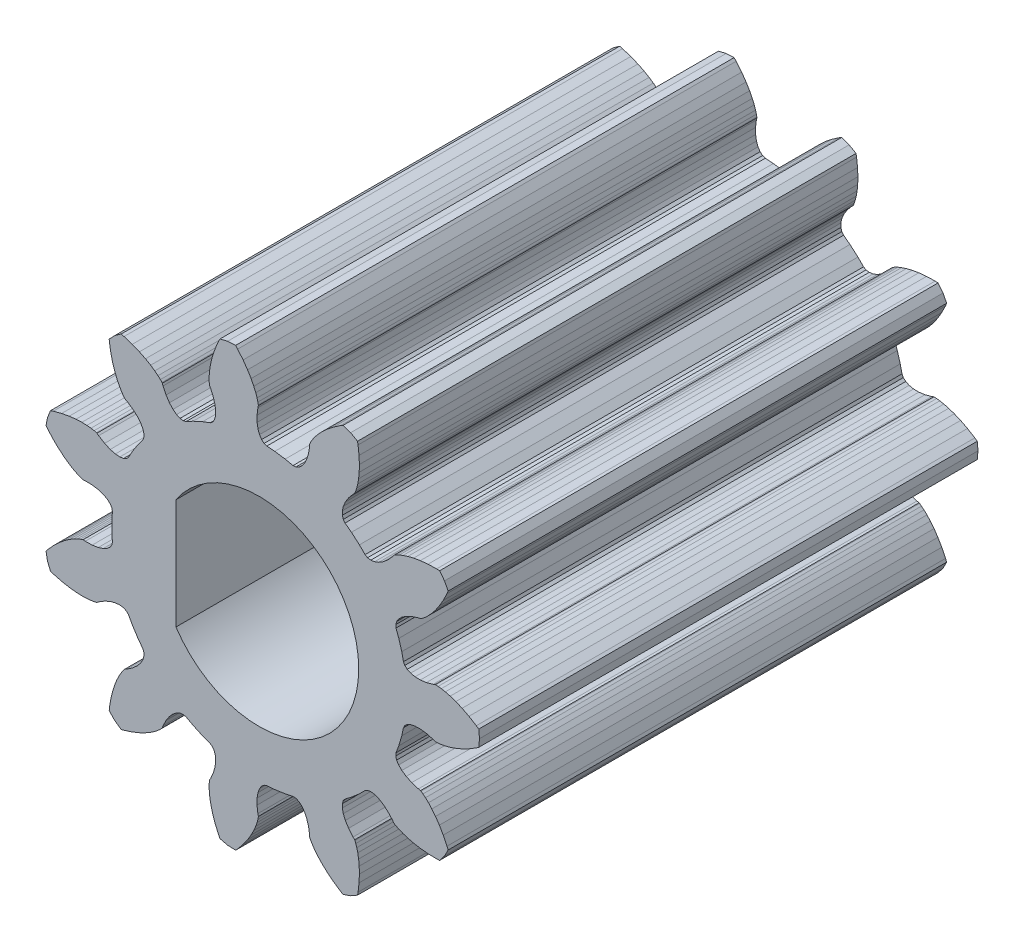
from build123d import *

# Parameters (mm, degrees)
BOSS_EXTRUDE1_DEPTH = 15


with BuildPart() as part:
    # Model → Boss-Extrude1 (new body)
    with BuildSketch(Plane.XY):
        Polygon((5.34350911, -3.778393981), (5.432682734, -3.774472376), (5.580572011, -3.586415862), (5.690198807, -3.373769544), (5.656721963, -3.291025269), (5.542565598, -3.05819118), (5.425718856, -2.857502407), (5.310117013, -2.688037058), (5.199541768, -2.548480823), (5.097585706, -2.437144774), (5.007618553, -2.351986199), (4.932755481, -2.290632311), (4.875827694, -2.250406645), (4.859603729, -2.240598683), (4.795175455, -2.228424948), (4.595393071, -2.165079302), (4.429229547, -2.086621619), (4.297677307, -1.99753099), (4.201261019, -1.902340691), (4.140035663, -1.805594294), (4.113588478, -1.71180183), (4.121044753, -1.625396341), (4.205247262, -1.39964068), (4.294381996, -1.096075651), (4.345599064, -0.860634591), (4.38604078, -0.783914501), (4.458997603, -0.719309687), (4.562808701, -0.671022364), (4.695383005, -0.64306977), (4.854217822, -0.639244475), (5.0364209, -0.663076455), (5.238735778, -0.717797218), (5.299517909, -0.742388575), (5.318468961, -0.74290893), (5.3881073, -0.739846431), (5.48425654, -0.728706289), (5.605981927, -0.705706252), (5.751945637, -0.667166016), (5.920417249, -0.609545331), (6.109287593, -0.529481083), (6.31608587, -0.423823062), (6.537999927, -0.289668152), (6.610897374, -0.238158187), (6.633638723, 0), (6.610897374, 0.238158187), (6.537999927, 0.289668152), (6.31608587, 0.423823062), (6.109287593, 0.529481083), (5.920417249, 0.609545331), (5.751945637, 0.667166016), (5.605981927, 0.705706252), (5.48425654, 0.728706289), (5.3881073, 0.739846431), (5.318468961, 0.74290893), (5.299517909, 0.742388575), (5.238735778, 0.717797218), (5.0364209, 0.663076455), (4.854217822, 0.639244475), (4.695383005, 0.64306977), (4.562808701, 0.671022364), (4.458997603, 0.719309687), (4.38604078, 0.783914501), (4.345599064, 0.860634591), (4.294381996, 1.096075651), (4.205247262, 1.39964068), (4.121044753, 1.625396341), (4.113588478, 1.71180183), (4.140035663, 1.805594294), (4.201261019, 1.902340691), (4.297677307, 1.99753099), (4.429229547, 2.086621619), (4.595393071, 2.165079302), (4.795175455, 2.228424948), (4.859603729, 2.240598683), (4.875827694, 2.250406645), (4.932755481, 2.290632311), (5.007618553, 2.351986199), (5.097585706, 2.437144774), (5.199541768, 2.548480823), (5.310117013, 2.688037058), (5.425718856, 2.857502407), (5.542565598, 3.05819118), (5.656721963, 3.291025269), (5.690198807, 3.373769544), (5.580572011, 3.586415862), (5.432682734, 3.774472376), (5.34350911, 3.778393981), (5.084293505, 3.771276476), (4.853200685, 3.74835807), (4.65102684, 3.713601384), (4.478147407, 3.670992359), (4.334518496, 3.62450053), (4.219681825, 3.578039679), (4.132773122, 3.535429159), (4.072533912, 3.500356169), (4.056872598, 3.489672706), (4.019034506, 3.436123839), (3.878420678, 3.280710122), (3.738026237, 3.162154964), (3.602337774, 3.079500422), (3.47569686, 3.031340561), (3.362259309, 3.015837924), (3.265956125, 3.030743516), (3.190456376, 3.07342012), (3.02008079, 3.243795706), (2.780976234, 3.450980983), (2.588087852, 3.595375418), (2.535100899, 3.664033174), (2.506641653, 3.757234844), (2.505842648, 3.871724019), (2.53548943, 4.003929775), (2.597992187, 4.150000092), (2.695360412, 4.305837678), (2.829180807, 4.467137938), (2.876799701, 4.512211691), (2.885145585, 4.529234011), (2.91128865, 4.59385148), (2.941097058, 4.685939687), (2.970742041, 4.806219554), (2.996320126, 4.955003008), (3.013892144, 5.132186674), (3.019522719, 5.337249073), (3.009319911, 5.56925133), (2.979474744, 5.82684142), (2.962902325, 5.914549283), (2.755713116, 6.034170028), (2.529629712, 6.112418255), (2.452491906, 6.067506419), (2.238273876, 5.921376255), (2.056256851, 5.777157854), (1.904968273, 5.638615237), (1.782569017, 5.509304566), (1.686876069, 5.392541498), (1.615387946, 5.291370752), (1.565312678, 5.208538109), (1.533598121, 5.146465056), (1.526198901, 5.129010409), (1.523318175, 5.063505419), (1.489049295, 4.856741506), (1.435037733, 4.681103595), (1.365575754, 4.538211449), (1.285075823, 4.429229547), (1.198027441, 4.354858929), (1.108953476, 4.315332879), (1.022366332, 4.310416477), (0.786925272, 4.361633545), (0.473764902, 4.406659209), (0.233431343, 4.423848204), (0.151736697, 4.452959875), (0.077406629, 4.515979878), (0.014836942, 4.611862326), (-0.031698426, 4.739109146), (-0.058089337, 4.895782858), (-0.060430133, 5.079523015), (-0.035058758, 5.287566196), (-0.019367905, 5.351229368), (-0.021549862, 5.37006158), (-0.034491757, 5.438555262), (-0.059201972, 5.532140434), (-0.099291231, 5.649353586), (-0.158211985, 5.788346748), (-0.239222185, 5.946903283), (-0.345350547, 6.122456869), (-0.479363585, 6.312113533), (-0.643734654, 6.512676591), (-0.705094711, 6.577501414), (-0.944065222, 6.566117846), (-1.17656287, 6.509714527), (-1.21717415, 6.430228439), (-1.318381893, 6.191480912), (-1.393534004, 5.97175084), (-1.445904262, 5.773408593), (-1.478962441, 5.5984515), (-1.496337591, 5.448488643), (-1.501780193, 5.324728999), (-1.499123481, 5.227973011), (-1.492244238, 5.158607652), (-1.489032163, 5.139923548), (-1.456040912, 5.083259806), (-1.373084718, 4.890791778), (-1.323565112, 4.71383491), (-1.30474692, 4.556072406), (-1.313547707, 4.420869448), (-1.346569674, 4.311242995), (-1.400134066, 4.229834544), (-1.470317799, 4.178886059), (-1.69607346, 4.094683551), (-1.983863439, 3.963254271), (-2.195337967, 3.847780443), (-2.279802834, 3.828103278), (-2.376404453, 3.84093321), (-2.480879388, 3.887766932), (-2.588822256, 3.969654849), (-2.695727906, 4.087189159), (-2.797034538, 4.240495685), (-2.888167414, 4.429229547), (-2.909386338, 4.491269531), (-2.92140338, 4.505932541), (-2.969321275, 4.556556176), (-3.040704795, 4.621925681), (-3.13780024, 4.69885777), (-3.262512909, 4.783931294), (-3.41638516, 4.873520119), (-3.600577454, 4.963827868), (-3.81585253, 5.050924289), (-4.062562848, 5.130782961), (-4.149229158, 5.152143321), (-4.344109523, 5.013369641), (-4.509205054, 4.840222431), (-4.500396013, 4.751398363), (-4.456460727, 4.495834126), (-4.40088766, 4.270355128), (-4.337712409, 4.075185513), (-4.270933774, 3.91012964), (-4.204474639, 3.774579141), (-4.142143731, 3.66752341), (-4.087598527, 3.587563421), (-4.044309595, 3.532928767), (-4.031506037, 3.518947277), (-3.973117298, 3.489115121), (-3.799274035, 3.372050217), (-3.661945385, 3.249956947), (-3.560821666, 3.127412566), (-3.495129121, 3.008914535), (-3.463640432, 2.898837871), (-3.464688935, 2.801393627), (-3.496186418, 2.720588843), (-3.640580853, 2.527700461), (-3.811629156, 2.261544105), (-3.927102984, 2.050069578), (-3.987521074, 1.987850939), (-4.075723912, 1.946417386), (-4.188934042, 1.929333005), (-4.324013311, 1.939863185), (-4.477491912, 1.98094178), (-4.64560024, 2.055140936), (-4.824303324, 2.164643812), (-4.875695166, 2.205363351), (-4.893731967, 2.211201757), (-4.961412269, 2.227882699), (-5.05680533, 2.244282182), (-5.180079843, 2.256507812), (-5.330989036, 2.260651456), (-5.508869987, 2.252828751), (-5.71264646, 2.229218592), (-5.940835258, 2.186102271), (-6.191556042, 2.119901993), (-6.276012664, 2.091016127), (-6.364929744, 1.868911999), (-6.410206494, 1.633993913), (-6.354773941, 1.564032879), (-6.179644768, 1.372791771), (-6.010990579, 1.213151836), (-5.852327516, 1.083119827), (-5.706913811, 0.980369247), (-5.577720696, 0.902267432), (-5.467405902, 0.845905053), (-5.378289922, 0.808127794), (-5.312335231, 0.785569961), (-5.294005229, 0.78073011), (-5.228757015, 0.787201038), (-5.01922069, 0.782706538), (-4.837683873, 0.754240617), (-4.686360692, 0.705821333), (-4.567031735, 0.641650518), (-4.481029826, 0.566072205), (-4.429229547, 0.483530028), (-4.412040552, 0.398523893), (-4.429229547, 0.158190334), (-4.429229547, -0.158190334), (-4.412040552, -0.398523893), (-4.429229547, -0.483530028), (-4.481029826, -0.566072205), (-4.567031735, -0.641650518), (-4.686360692, -0.705821333), (-4.837683873, -0.754240617), (-5.01922069, -0.782706538), (-5.228757015, -0.787201038), (-5.294005229, -0.78073011), (-5.312335231, -0.785569961), (-5.378289922, -0.808127794), (-5.467405902, -0.845905053), (-5.577720696, -0.902267432), (-5.706913811, -0.980369247), (-5.852327516, -1.083119827), (-6.010990579, -1.213151836), (-6.179644768, -1.372791771), (-6.354773941, -1.564032879), (-6.410206494, -1.633993913), (-6.364929744, -1.868911999), (-6.276012664, -2.091016127), (-6.191556042, -2.119901993), (-5.940835258, -2.186102271), (-5.71264646, -2.229218592), (-5.508869987, -2.252828751), (-5.330989036, -2.260651456), (-5.180079843, -2.256507812), (-5.05680533, -2.244282182), (-4.961412269, -2.227882699), (-4.893731967, -2.211201757), (-4.875695166, -2.205363351), (-4.824303324, -2.164643812), (-4.64560024, -2.055140936), (-4.477491912, -1.98094178), (-4.324013311, -1.939863186), (-4.188934042, -1.929333005), (-4.075723912, -1.946417386), (-3.987521074, -1.987850939), (-3.927102984, -2.050069578), (-3.811629156, -2.261544105), (-3.640580853, -2.527700461), (-3.496186418, -2.720588843), (-3.464688935, -2.801393627), (-3.463640432, -2.898837871), (-3.495129121, -3.008914535), (-3.560821666, -3.127412566), (-3.661945385, -3.249956947), (-3.799274035, -3.372050217), (-3.973117298, -3.489115121), (-4.031506037, -3.518947277), (-4.044309595, -3.532928767), (-4.087598527, -3.587563421), (-4.142143731, -3.66752341), (-4.204474639, -3.774579141), (-4.270933774, -3.91012964), (-4.337712409, -4.075185513), (-4.40088766, -4.270355128), (-4.456460727, -4.495834126), (-4.500396013, -4.751398363), (-4.509205054, -4.840222431), (-4.344109523, -5.013369641), (-4.149229158, -5.152143321), (-4.062562848, -5.130782961), (-3.81585253, -5.050924289), (-3.600577454, -4.963827868), (-3.41638516, -4.873520119), (-3.262512909, -4.783931294), (-3.13780024, -4.69885777), (-3.040704795, -4.621925681), (-2.969321275, -4.556556176), (-2.92140338, -4.505932541), (-2.909386338, -4.491269531), (-2.888167414, -4.429229547), (-2.797034538, -4.240495685), (-2.695727906, -4.087189159), (-2.588822255, -3.969654849), (-2.480879388, -3.887766932), (-2.376404453, -3.84093321), (-2.279802834, -3.828103278), (-2.195337967, -3.847780443), (-1.983863439, -3.963254271), (-1.69607346, -4.094683551), (-1.470317799, -4.178886059), (-1.400134066, -4.229834544), (-1.346569674, -4.311242995), (-1.313547707, -4.420869448), (-1.30474692, -4.556072406), (-1.323565112, -4.71383491), (-1.373084718, -4.890791778), (-1.456040912, -5.083259806), (-1.489032163, -5.139923548), (-1.492244238, -5.158607652), (-1.499123481, -5.227973011), (-1.501780193, -5.324728999), (-1.496337591, -5.448488643), (-1.478962441, -5.5984515), (-1.445904262, -5.773408593), (-1.393534004, -5.97175084), (-1.318381893, -6.191480912), (-1.21717415, -6.430228439), (-1.17656287, -6.509714527), (-0.944065222, -6.566117846), (-0.705094711, -6.577501414), (-0.643734654, -6.512676591), (-0.479363585, -6.312113533), (-0.345350547, -6.122456869), (-0.239222185, -5.946903283), (-0.158211985, -5.788346748), (-0.099291231, -5.649353586), (-0.059201972, -5.532140434), (-0.034491757, -5.438555262), (-0.021549862, -5.37006158), (-0.019367905, -5.351229368), (-0.035058758, -5.287566196), (-0.060430133, -5.079523015), (-0.058089337, -4.895782858), (-0.031698426, -4.739109146), (0.014836942, -4.611862326), (0.077406629, -4.515979878), (0.151736697, -4.452959875), (0.233431343, -4.423848204), (0.473764902, -4.406659209), (0.786925272, -4.361633545), (1.022366332, -4.310416477), (1.108953476, -4.315332879), (1.198027441, -4.354858929), (1.285075823, -4.429229547), (1.365575754, -4.538211449), (1.435037733, -4.681103595), (1.489049295, -4.856741506), (1.523318175, -5.063505419), (1.526198901, -5.129010409), (1.533598121, -5.146465056), (1.565312678, -5.208538109), (1.615387946, -5.291370752), (1.686876069, -5.392541498), (1.782569017, -5.509304566), (1.904968273, -5.638615237), (2.056256851, -5.777157854), (2.238273876, -5.921376255), (2.452491906, -6.067506419), (2.529629712, -6.112418255), (2.755713116, -6.034170028), (2.962902325, -5.914549283), (2.979474744, -5.82684142), (3.009319911, -5.56925133), (3.019522719, -5.337249073), (3.013892144, -5.132186674), (2.996320126, -4.955003008), (2.970742041, -4.806219555), (2.941097058, -4.685939687), (2.91128865, -4.59385148), (2.885145585, -4.529234011), (2.876799701, -4.512211691), (2.829180807, -4.467137938), (2.695360412, -4.305837678), (2.597992187, -4.150000092), (2.53548943, -4.003929775), (2.505842648, -3.871724019), (2.506641653, -3.757234844), (2.535100899, -3.664033174), (2.588087852, -3.595375418), (2.780976234, -3.450980983), (3.02008079, -3.243795706), (3.190456376, -3.07342012), (3.265956125, -3.030743516), (3.362259309, -3.015837924), (3.47569686, -3.031340561), (3.602337775, -3.079500422), (3.738026237, -3.162154964), (3.878420678, -3.280710122), (4.019034506, -3.436123839), (4.056872598, -3.489672706), (4.072533912, -3.500356169), (4.132773122, -3.535429159), (4.219681825, -3.578039679), (4.334518496, -3.62450053), (4.478147407, -3.670992359), (4.65102684, -3.713601384), (4.853200685, -3.74835807), (5.084293505, -3.771276476), align=None)
        with BuildLine():
            Line((-2.5, -1.658312395), (-2.5, 1.658312395))
            ThreePointArc((-2.5, 1.658312395), (3, 0), (-2.5, -1.658312395))
        make_face(mode=Mode.SUBTRACT)
    extrude(amount=BOSS_EXTRUDE1_DEPTH)


solid = part.part
